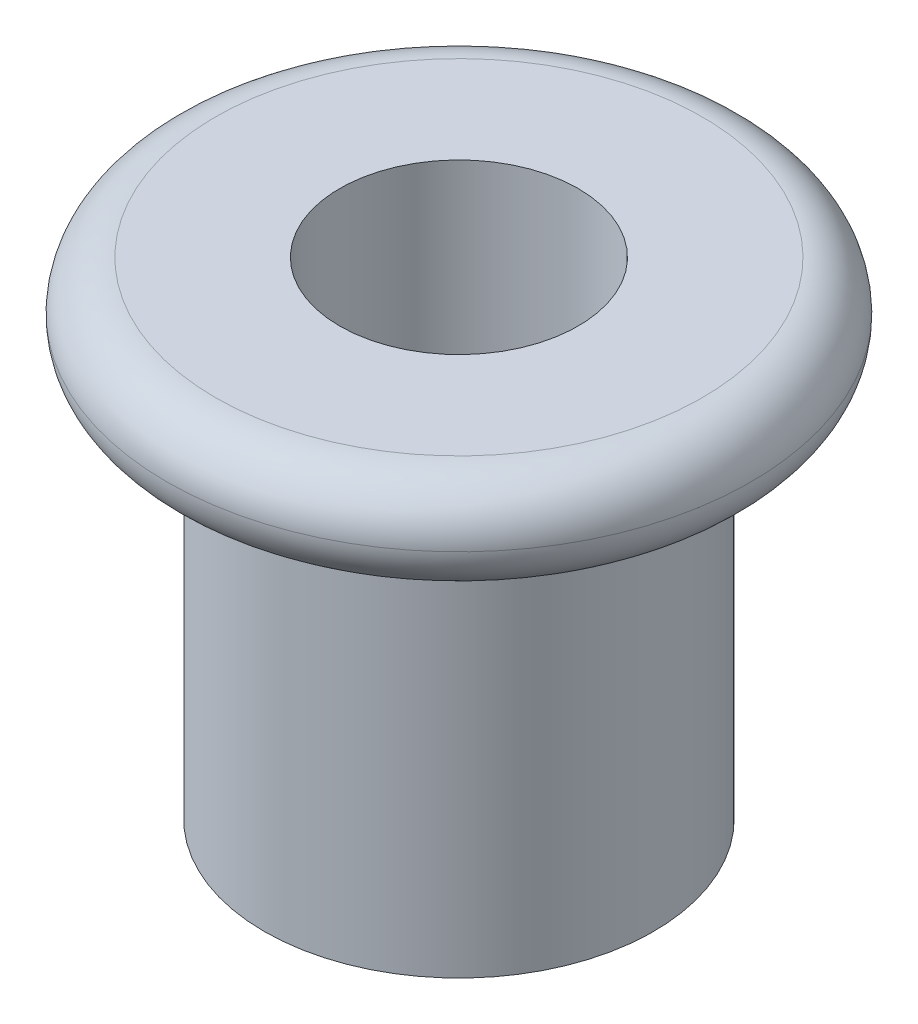
from build123d import *

# Parameters (mm, degrees)
SKETCH1_R           = 4
SKETCH1_R_2         = 2.45
BOSS_EXTRUDE1_DEPTH = 8
SKETCH2_R           = 6
BOSS_EXTRUDE2_DEPTH = 2
FILLET1_R           = 1
CUT_EXTRUDE1_REACH  = 15.115
SKETCH3_R           = 2.45
CHAMFER1_SIZE       = 1


with BuildPart() as part:
    # Sketch1 → Boss-Extrude1 (new body)
    with BuildSketch(Plane(origin=(0, 0, 0), x_dir=(1, 0, 0), z_dir=(0, 1, 0))):
        with Locations(Location((0, 0, 0), (0, 0, 270))):
            Circle(SKETCH1_R)
        with Locations(Location((0, 0, 0), (0, 0, 270))):
            Circle(SKETCH1_R_2, mode=Mode.SUBTRACT)
    extrude(amount=BOSS_EXTRUDE1_DEPTH)

    # Sketch2 → Boss-Extrude2 (add)
    with BuildSketch(Plane(origin=(0, 8, 0), x_dir=(1, 0, 0), z_dir=(0, 1, 0))):
        with Locations(Location((0, 0, 0), (0, 0, 270))):
            Circle(SKETCH2_R)
    extrude(amount=BOSS_EXTRUDE2_DEPTH)

    # Fillet1
    fillet1_edges = [part.edges().sort_by_distance(p)[0] for p in [
        (0, 8, -6),
        (0, 10, -6),
    ]]
    fillet(fillet1_edges, radius=FILLET1_R - 0.0001)  # a hair under: the kernel refuses the full size

    # Sketch3 → Cut-Extrude1 (cut, up to next)
    with BuildSketch(Plane(origin=(0, 10, 0), x_dir=(1, 0, 0), z_dir=(0, 1, 0)), mode=Mode.PRIVATE) as cut_extrude1_sk1:
        with Locations(Location((0, 0, 0), (0, 0, 270))):
            Circle(SKETCH3_R)
    cut_extrude1_tool1 = extrude(cut_extrude1_sk1.sketch, amount=-CUT_EXTRUDE1_REACH, mode=Mode.PRIVATE) & part.part
    add(cut_extrude1_tool1.solids().sort_by_distance((0, 10, 0))[0], mode=Mode.SUBTRACT)

    # Chamfer1
    chamfer1_edges = [part.edges().sort_by_distance(p)[0] for p in [
        (0, 0, -2.45),
    ]]
    chamfer(chamfer1_edges, length=CHAMFER1_SIZE)


solid = part.part
